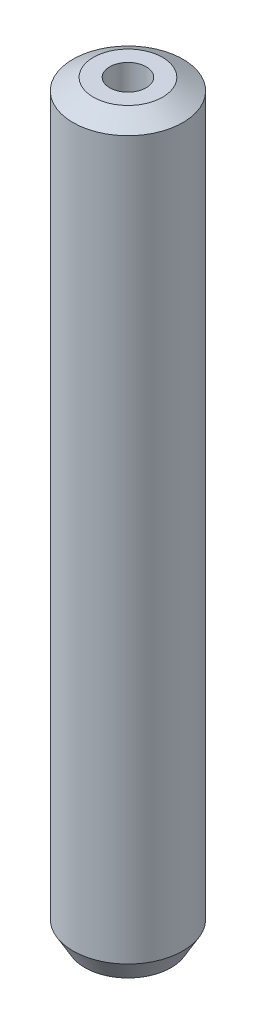
from build123d import *
from OCP.BRepFilletAPI import BRepFilletAPI_MakeChamfer

# Parameters (mm, degrees)
SKETCH1_R           = 15
BOSS_EXTRUDE1_DEPTH = 204.605867922
SKETCH2_R           = 4.977804044
CUT_EXTRUDE1_DEPTH  = 206.702603747
CHAMFER1_SIZE       = 3.213885308
CHAMFER1_SIZE2      = 5.566612644


with BuildPart() as part:
    # Sketch1 → Boss-Extrude1 (new body)
    with BuildSketch(Plane(origin=(0, 0, 0), x_dir=(1, 0, 0), z_dir=(0, 1, 0))):
        Circle(SKETCH1_R)
    extrude(amount=BOSS_EXTRUDE1_DEPTH)

    # Sketch2 → Cut-Extrude1 (cut, through all)
    with BuildSketch(Plane(origin=(0, 0, 0), x_dir=(1, 0, 0), z_dir=(0, 1, 0))):
        Circle(SKETCH2_R)
    extrude(amount=CUT_EXTRUDE1_DEPTH, mode=Mode.SUBTRACT)

    # Chamfer1: one chamfer whose edges measure the first distance from different faces: ONE call of the kernel's chamfer builder (chamfer() names one face for all edges)
    chamfer1_edges_1 = [part.edges().sort_by_distance(p)[0] for p in [
        (-15, 204.605867922, 0),
    ]]
    chamfer1_side_1 = [part.faces().sort_by_distance(p)[0] for p in [
        (-15, 102.302933961, 0),
    ]]
    chamfer1_edges_2 = [part.edges().sort_by_distance(p)[0] for p in [
        (-15, 0, 0),
    ]]
    chamfer1_side_2 = [part.faces().sort_by_distance(p)[0] for p in [
        (-14.575735931, 0, 0),
    ]]
    chamfer1 = BRepFilletAPI_MakeChamfer(part.part.solid().wrapped)
    for e in chamfer1_edges_1:
        chamfer1.Add(CHAMFER1_SIZE, CHAMFER1_SIZE2, e.wrapped, chamfer1_side_1[0].wrapped)  # the first distance lies on this face
    for e in chamfer1_edges_2:
        chamfer1.Add(CHAMFER1_SIZE, CHAMFER1_SIZE2, e.wrapped, chamfer1_side_2[0].wrapped)  # the first distance lies on this face
    add(Compound.cast(chamfer1.Shape()), mode=Mode.REPLACE)


solid = part.part
